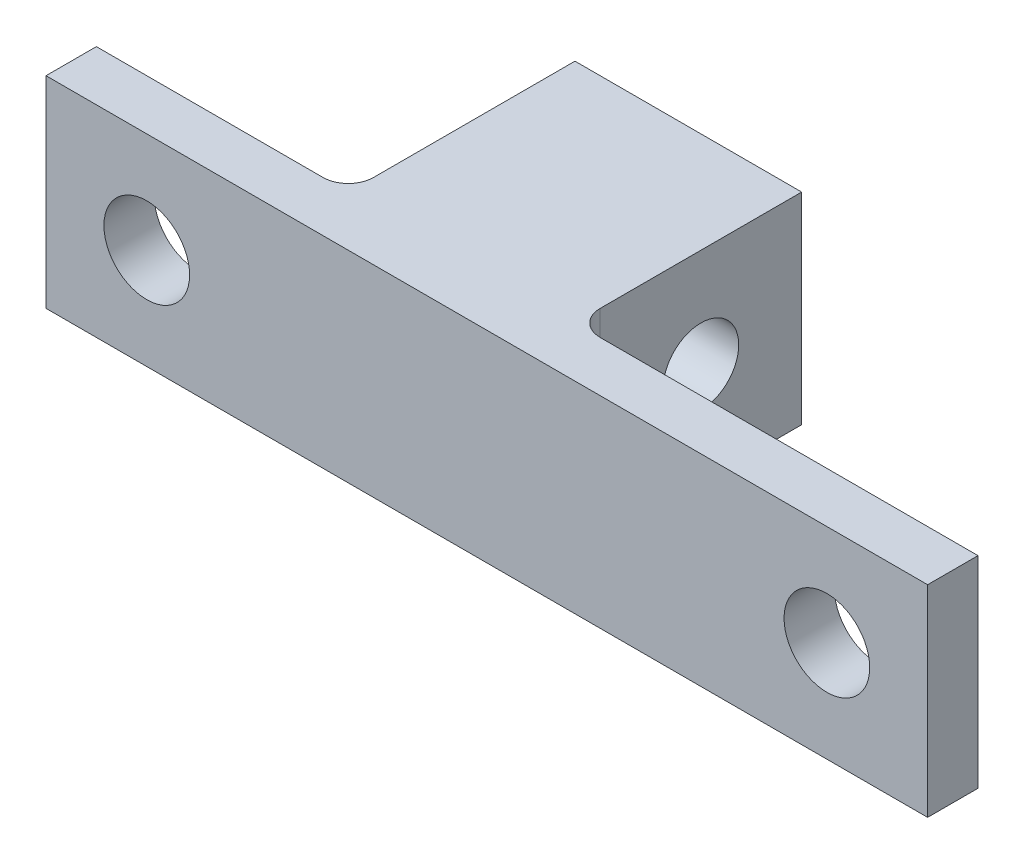
from build123d import *

# Parameters (mm, degrees)
BOSS_EXTRUDE1_DEPTH      = 8
M3_CLEARANCE_HOLE1_D     = 3.4
M3_CLEARANCE_HOLE1_DEPTH = 3.9
M3_CLEARANCE_HOLE1_TIP   = 1.021463052
SKETCH4_R                = 1.5
CUT_EXTRUDE1_DEPTH       = 28.748873851
FILLET1_R                = 1


with BuildPart() as part:
    # Sketch1 → Boss-Extrude1 (new body)
    with BuildSketch(Plane(origin=(0, 0, 0), x_dir=(1, 0, 0), z_dir=(0, 1, 0))):
        Polygon((0, 0), (10, 0), (10, 9), (19, 9), (19, 0), (35, 0), (35, -2), (0, -2), align=None)
    extrude(amount=BOSS_EXTRUDE1_DEPTH)

    # M3 Clearance Hole1
    with Locations(Plane(origin=(0, 0, 0), x_dir=(-1, 0, 0), z_dir=(0, 0, -1))):
        with Locations((-4, 4), (-31, 4)):
            Hole(M3_CLEARANCE_HOLE1_D / 2, depth=M3_CLEARANCE_HOLE1_DEPTH)
            with Locations((0, 0, -(M3_CLEARANCE_HOLE1_DEPTH + M3_CLEARANCE_HOLE1_TIP / 2))):  # 118° drill point
                Cone(0, M3_CLEARANCE_HOLE1_D / 2, M3_CLEARANCE_HOLE1_TIP, mode=Mode.SUBTRACT)

    # Sketch4 → Cut-Extrude1 (cut, through all)
    with BuildSketch(Plane.ZY.offset(-10)):
        with Locations((-5, 4)):
            Circle(SKETCH4_R)
    extrude(amount=-CUT_EXTRUDE1_DEPTH, mode=Mode.SUBTRACT)

    # Fillet1
    fillet1_edges = [part.edges().sort_by_distance(p)[0] for p in [
        (10, 4, 0),
        (19, 4, 0),
    ]]
    fillet(fillet1_edges, radius=FILLET1_R)


solid = part.part
